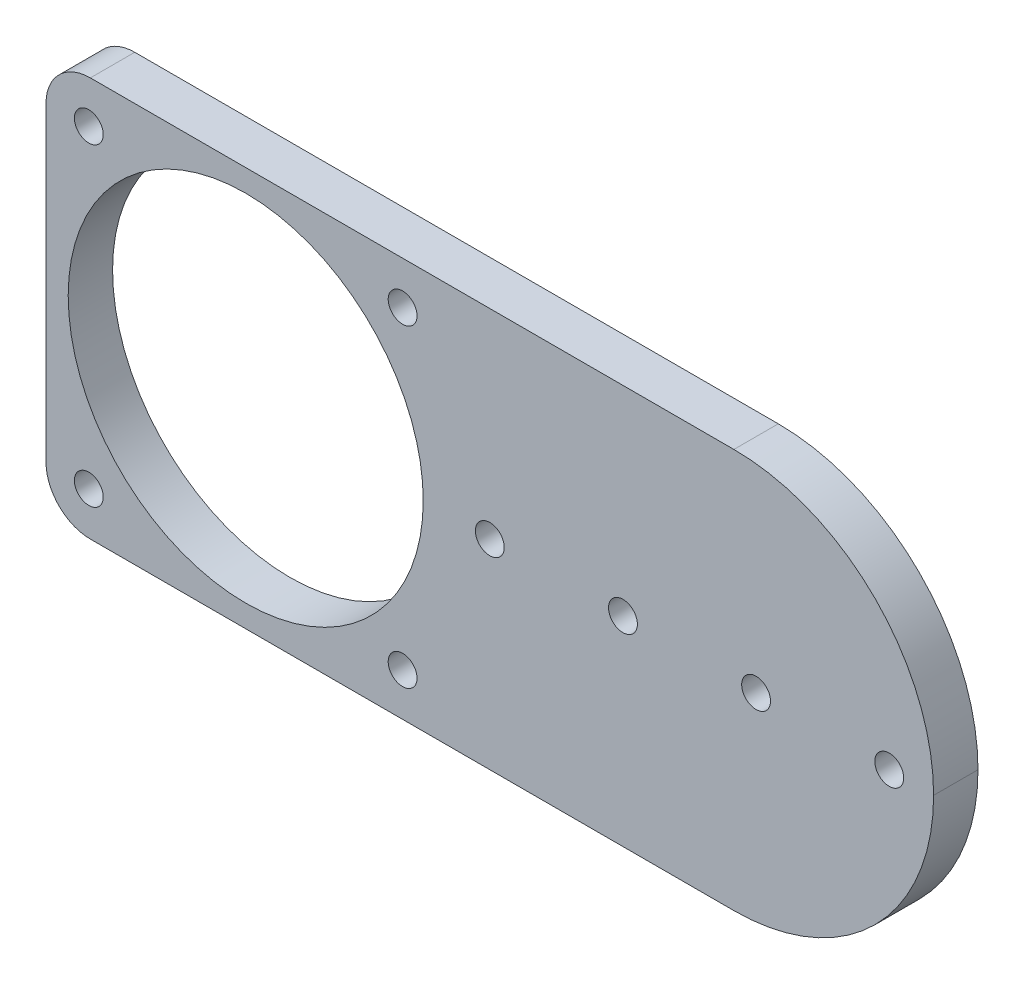
from build123d import *

# Parameters (mm, degrees)
SKETCH1_W           = 200
SKETCH1_H           = 90
SKETCH1_R           = 3.25
SKETCH1_R_2         = 40
BOSS_EXTRUDE1_DEPTH = 10
FILLET1_R           = 45
FILLET2_R           = 10


with BuildPart() as part:
    # Sketch1 → Boss-Extrude1 (new body)
    with BuildSketch(Plane.XY):
        with Locations((40.245231608, 0)):
            Rectangle(SKETCH1_W, SKETCH1_H)
        with Locations((-50.110107452, 35.355339059)):
            Circle(SKETCH1_R, mode=Mode.SUBTRACT)
        with Locations((20.600570667, 35.355339059)):
            Circle(SKETCH1_R, mode=Mode.SUBTRACT)
        with Locations((20.600570667, -35.355339059)):
            Circle(SKETCH1_R, mode=Mode.SUBTRACT)
        with Locations((-50.110107452, -35.355339059)):
            Circle(SKETCH1_R, mode=Mode.SUBTRACT)
        with Locations((-14.754768392, 0)):
            Circle(SKETCH1_R_2, mode=Mode.SUBTRACT)
        with Locations((40.245231608, 0)):
            Circle(SKETCH1_R, mode=Mode.SUBTRACT)
        with Locations((70.245231608, 0)):
            Circle(SKETCH1_R, mode=Mode.SUBTRACT)
        with Locations((100.245231608, 0)):
            Circle(SKETCH1_R, mode=Mode.SUBTRACT)
        with Locations((130.245231608, 0)):
            Circle(SKETCH1_R, mode=Mode.SUBTRACT)
    extrude(amount=BOSS_EXTRUDE1_DEPTH)

    # Fillet1
    fillet1_edges = [part.edges().sort_by_distance(p)[0] for p in [
        (140.245231608, -45, 5),
        (140.245231608, 45, 5),
    ]]
    fillet(fillet1_edges, radius=FILLET1_R - 0.0001)  # a hair under: the kernel refuses the full size

    # Fillet2
    fillet2_edges = [part.edges().sort_by_distance(p)[0] for p in [
        (-59.754768392, -45, 5),
        (-59.754768392, 45, 5),
    ]]
    fillet(fillet2_edges, radius=FILLET2_R)


solid = part.part
